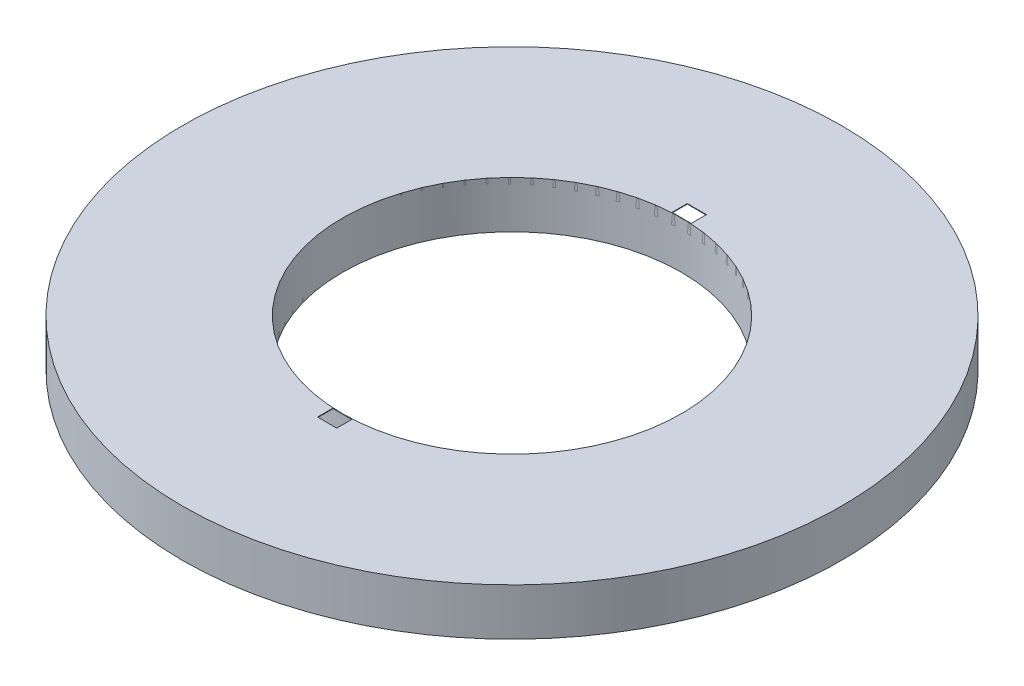
from build123d import *

# Parameters (mm, degrees)
SKETCH1_R               = 1750
BOSS_EXTRUDE1_DEPTH     = 500
SKETCH2_R               = 900
CUT_EXTRUDE2_DEPTH      = 300
SKETCH3_R               = 600
CUT_EXTRUDE3_DEPTH      = 300
SKETCH4_R               = 1748.5
SKETCH4_R_2             = 900.75
CUT_EXTRUDE5_DEPTH      = 497
CUT_EXTRUDE6_DEPTH      = 2525.876234591
CUT_EXTRUDE6_DEPTH_BACK = 2525.876234591
SKETCH5_W               = 3500
SKETCH5_H               = 250
CUT_EXTRUDE7_DEPTH      = 10
CIRPATTERN1_COUNT       = 2


with BuildPart() as part:
    # Sketch1 → Boss-Extrude1 (new body)
    with BuildSketch(Plane(origin=(0, 0, 0), x_dir=(1, 0, 0), z_dir=(0, 1, 0))):
        Circle(SKETCH1_R)
    extrude(amount=BOSS_EXTRUDE1_DEPTH)

    # Sketch2 → Cut-Extrude2 (cut)
    with BuildSketch(Plane(origin=(0, 500, 0), x_dir=(1, 0, 0), z_dir=(0, 1, 0))):
        Circle(SKETCH2_R)
    extrude(amount=-CUT_EXTRUDE2_DEPTH, mode=Mode.SUBTRACT)

    # Sketch3 → Cut-Extrude3 (cut)
    with BuildSketch(Plane.XZ):
        Circle(SKETCH3_R)
    extrude(amount=-CUT_EXTRUDE3_DEPTH, mode=Mode.SUBTRACT)

    # Sketch4 → Cut-Extrude5 (cut)
    with BuildSketch(Plane(origin=(0, 0, 0), x_dir=(-1, 0, 0), z_dir=(0, -1, 0))):
        Circle(SKETCH4_R)
        Circle(SKETCH4_R_2, mode=Mode.SUBTRACT)
    extrude(amount=-CUT_EXTRUDE5_DEPTH, mode=Mode.SUBTRACT)

    # Sketch5 → Cut-Extrude6 (cut, two sides: drawn at the far end of the back side and taken through both)
    with BuildSketch(Plane.XY.offset(-CUT_EXTRUDE6_DEPTH_BACK)):
        with Locations((0, 125)):
            Rectangle(SKETCH5_W, SKETCH5_H)
    extrude(amount=CUT_EXTRUDE6_DEPTH + CUT_EXTRUDE6_DEPTH_BACK, mode=Mode.SUBTRACT)

    # Sketch6 → Cut-Extrude7 (cut)
    with BuildSketch(Plane.XZ.offset(-497)):
        Polygon((0, 900.75), (51, 900.75), (51, 981.75), (-51, 981.75), (-51, 900.75), align=None)
    cut_extrude7 = extrude(amount=-CUT_EXTRUDE7_DEPTH, mode=Mode.SUBTRACT)

    # CirPattern1: Cut-Extrude7 ×2 about axis
    cirpattern1_axis = Axis((0, 497, 0), (0, -1, 0))
    for i in range(1, CIRPATTERN1_COUNT):
        add(cut_extrude7.rotate(cirpattern1_axis, i * 360 / CIRPATTERN1_COUNT), mode=Mode.SUBTRACT)


solid = part.part
